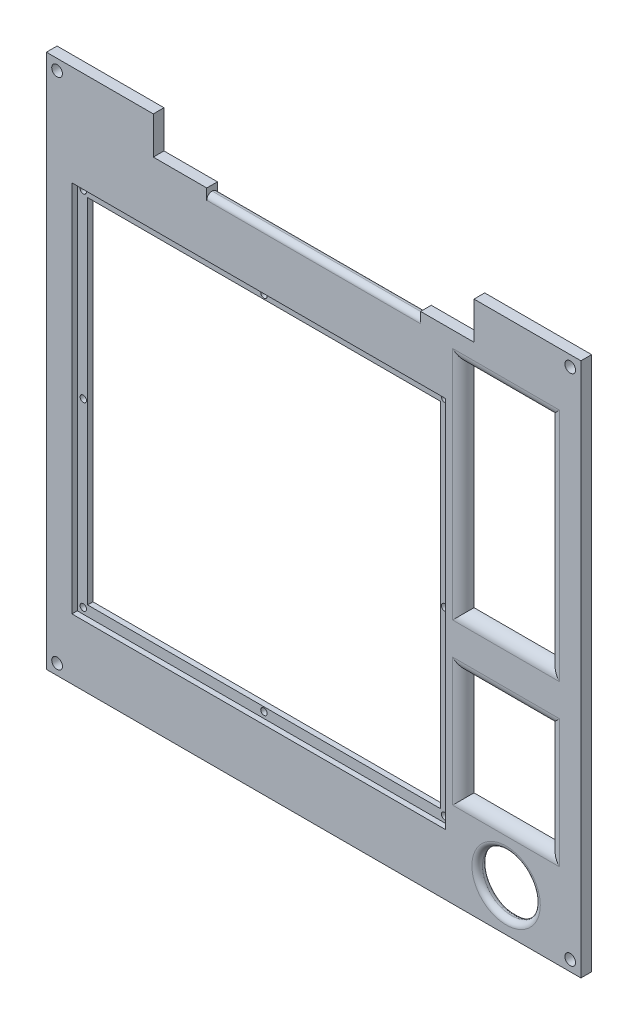
from build123d import *

# Parameters (mm, degrees)
SKETCH1_W                        = 250
SKETCH1_H                        = 250
BOSS_EXTRUDE1_DEPTH              = 50
SKETCH2_W                        = 40
SKETCH2_H                        = 100
SKETCH2_H_2                      = 50
CUT_EXTRUDE1_DEPTH               = 45
FILLET1_R                        = 5
FILLET2_R                        = 5
SKETCH5_R                        = 6.25
CUT_EXTRUDE2_DEPTH               = 22
FILLET5_R                        = 1.5
LPATTERN4_COUNT                  = 10
LPATTERN4_PITCH                  = 16.5
LPATTERN4_COUNT_DIR2             = 10
LPATTERN4_PITCH_DIR2             = 16.5
FILLET5_OF_LPATTERN4_R           = 1.5
CUT_EXTRUDE4_DEPTH               = 45
SKETCH8_W                        = 100
SKETCH8_H                        = 20
CUT_EXTRUDE5_DEPTH               = 30
FILLET6_R                        = 2.5
FILLET7_R                        = 2
SKETCH10_R                       = 13.5
CUT_EXTRUDE6_DEPTH               = 358.071421427
SKETCH4_W                        = 25
SKETCH4_H                        = 17.5
CUT_EXTRUDE7_DEPTH               = 10
VERRUNDUNG1_R                    = 2.5
SKIZZE2_W                        = 25
SKIZZE2_H                        = 5
AUFSATZ_LINEAR_AUSTRAGEN1_DEPTH  = 12.5
AUFSATZ_LINEAR_AUSTRAGEN2_DEPTH  = 10
SKIZZE11_W                       = 164
SKIZZE11_H                       = 164
SCHNITT_LINEAR_AUSTRAGEN6_DEPTH  = 10
SKIZZE12_W                       = 174
SKIZZE12_H                       = 174
SCHNITT_LINEAR_AUSTRAGEN7_DEPTH  = 2.5
SKIZZE13_R                       = 1.5
SCHNITT_LINEAR_AUSTRAGEN8_DEPTH  = 2.5
SKIZZE14_W                       = 10
SKIZZE14_H                       = 10
AUFSATZ_LINEAR_AUSTRAGEN3_DEPTH  = 45
SKIZZE16_W                       = 45
SKIZZE16_H                       = 250
SCHNITT_LINEAR_AUSTRAGEN9_DEPTH  = 358.071421427
SKIZZE17_R                       = 2.5
SCHNITT_LINEAR_AUSTRAGEN10_DEPTH = 5
SKIZZE18_W                       = 174.6
SKIZZE18_H                       = 174.6
SCHNITT_LINEAR_AUSTRAGEN11_DEPTH = 2.5
SKIZZE19_W                       = 165
SKIZZE19_H                       = 165
SCHNITT_LINEAR_AUSTRAGEN12_DEPTH = 2.5


with BuildPart() as part:
    # Sketch1 → Boss-Extrude1 (new body)
    with BuildSketch(Plane.XY):
        with Locations((-125, 125)):
            Rectangle(SKETCH1_W, SKETCH1_H)
    extrude(amount=BOSS_EXTRUDE1_DEPTH)

    # Sketch2 → Cut-Extrude1 (cut)
    with BuildSketch(Plane.XY.offset(50)):
        with Locations((-35, 170)):
            Rectangle(SKETCH2_W, SKETCH2_H)
        with Locations((-35, 70)):
            Rectangle(SKETCH2_W, SKETCH2_H_2)
    extrude(amount=-CUT_EXTRUDE1_DEPTH, mode=Mode.SUBTRACT)

    # Fillet1
    fillet1_edges = [part.edges().sort_by_distance(p)[0] for p in [
        (-55, 170, 50),
        (-35, 120, 50),
        (-15, 170, 50),
        (-35, 220, 50),
    ]]
    fillet(fillet1_edges, radius=FILLET1_R)

    # Fillet2
    fillet2_edges = [part.edges().sort_by_distance(p)[0] for p in [
        (-55, 70, 50),
        (-35, 45, 50),
        (-15, 70, 50),
        (-35, 95, 50),
    ]]
    fillet(fillet2_edges, radius=FILLET2_R)

    # Sketch5 → Cut-Extrude2 (cut)
    with BuildSketch(Plane.XY.offset(50)):
        with Locations((-225, 190)):
            Circle(SKETCH5_R)
    cut_extrude2 = extrude(amount=-CUT_EXTRUDE2_DEPTH, mode=Mode.SUBTRACT)

    # Fillet5
    fillet5_edges = [part.edges().sort_by_distance(p)[0] for p in [
        (-231.25, 190, 50),
    ]]
    fillet(fillet5_edges, radius=FILLET5_R)

    # LPattern4: Cut-Extrude2 10 × 10
    with Locations(*[(i * LPATTERN4_PITCH, -j * LPATTERN4_PITCH_DIR2, 0) for i in range(LPATTERN4_COUNT) for j in range(LPATTERN4_COUNT_DIR2) if (i, j) != (0, 0)]):
        add(cut_extrude2, mode=Mode.SUBTRACT)

    # Fillet5 of LPattern4
    fillet5_of_lpattern4_edges = [part.edges().sort_by_distance(p)[0] for p in [
        (-231.25, 173.5, 50),
        (-231.25, 157, 50),
        (-231.25, 140.5, 50),
        (-231.25, 124, 50),
        (-231.25, 107.5, 50),
        (-231.25, 91, 50),
        (-231.25, 74.5, 50),
        (-231.25, 58, 50),
        (-231.25, 41.5, 50),
        (-214.75, 190, 50),
        (-214.75, 173.5, 50),
        (-214.75, 157, 50),
        (-214.75, 140.5, 50),
        (-214.75, 124, 50),
        (-214.75, 107.5, 50),
        (-214.75, 91, 50),
        (-214.75, 74.5, 50),
        (-214.75, 58, 50),
        (-214.75, 41.5, 50),
        (-198.25, 190, 50),
        (-198.25, 173.5, 50),
        (-198.25, 157, 50),
        (-198.25, 140.5, 50),
        (-198.25, 124, 50),
        (-198.25, 107.5, 50),
        (-198.25, 91, 50),
        (-198.25, 74.5, 50),
        (-198.25, 58, 50),
        (-198.25, 41.5, 50),
        (-181.75, 190, 50),
        (-181.75, 173.5, 50),
        (-181.75, 157, 50),
        (-181.75, 140.5, 50),
        (-181.75, 124, 50),
        (-181.75, 107.5, 50),
        (-181.75, 91, 50),
        (-181.75, 74.5, 50),
        (-181.75, 58, 50),
        (-181.75, 41.5, 50),
        (-165.25, 190, 50),
        (-165.25, 173.5, 50),
        (-165.25, 157, 50),
        (-165.25, 140.5, 50),
        (-165.25, 124, 50),
        (-165.25, 107.5, 50),
        (-165.25, 91, 50),
        (-165.25, 74.5, 50),
        (-165.25, 58, 50),
        (-165.25, 41.5, 50),
        (-148.75, 190, 50),
        (-148.75, 173.5, 50),
        (-148.75, 157, 50),
        (-148.75, 140.5, 50),
        (-148.75, 124, 50),
        (-148.75, 107.5, 50),
        (-148.75, 91, 50),
        (-148.75, 74.5, 50),
        (-148.75, 58, 50),
        (-148.75, 41.5, 50),
        (-132.25, 190, 50),
        (-132.25, 173.5, 50),
        (-132.25, 157, 50),
        (-132.25, 140.5, 50),
        (-132.25, 124, 50),
        (-132.25, 107.5, 50),
        (-132.25, 91, 50),
        (-132.25, 74.5, 50),
        (-132.25, 58, 50),
        (-132.25, 41.5, 50),
        (-115.75, 190, 50),
        (-115.75, 173.5, 50),
        (-115.75, 157, 50),
        (-115.75, 140.5, 50),
        (-115.75, 124, 50),
        (-115.75, 107.5, 50),
        (-115.75, 91, 50),
        (-115.75, 74.5, 50),
        (-115.75, 58, 50),
        (-115.75, 41.5, 50),
        (-99.25, 190, 50),
        (-99.25, 173.5, 50),
        (-99.25, 157, 50),
        (-99.25, 140.5, 50),
        (-99.25, 124, 50),
        (-99.25, 107.5, 50),
        (-99.25, 91, 50),
        (-99.25, 74.5, 50),
        (-99.25, 58, 50),
        (-99.25, 41.5, 50),
        (-82.75, 190, 50),
        (-82.75, 173.5, 50),
        (-82.75, 157, 50),
        (-82.75, 140.5, 50),
        (-82.75, 124, 50),
        (-82.75, 107.5, 50),
        (-82.75, 91, 50),
        (-82.75, 74.5, 50),
        (-82.75, 58, 50),
        (-82.75, 41.5, 50),
    ]]
    fillet(fillet5_of_lpattern4_edges, radius=FILLET5_OF_LPATTERN4_R)

    # Sketch7 → Cut-Extrude4 (cut)
    with BuildSketch(Plane(origin=(0, 0, 0), x_dir=(-1, 0, 0), z_dir=(0, 0, -1))):
        Polygon((5, 245), (245, 245), (245, 5), (5, 5), (5, 40), (60, 40), (60, 100), (5, 100), (5, 115), (60, 115), (60, 225), (5, 225), align=None)
    extrude(amount=-CUT_EXTRUDE4_DEPTH, mode=Mode.SUBTRACT)

    # Sketch8 → Cut-Extrude5 (cut)
    with BuildSketch(Plane.XY.offset(50)):
        with Locations((-125, 240)):
            Rectangle(SKETCH8_W, SKETCH8_H)
    extrude(amount=-CUT_EXTRUDE5_DEPTH, mode=Mode.SUBTRACT)

    # Fillet6
    fillet6_edges = [part.edges().sort_by_distance(p)[0] for p in [
        (-125, 230, 45),
        (-125, 230, 50),
    ]]
    fillet(fillet6_edges, radius=FILLET6_R - 0.0001)  # a hair under: the kernel refuses the full size

    # Fillet7
    fillet7_edges = [part.edges().sort_by_distance(p)[0] for p in [
        (-125, 245, 20),
        (-125, 250, 20),
    ]]
    fillet(fillet7_edges, radius=FILLET7_R)

    # Sketch10 → Cut-Extrude6 (cut, through all)
    with BuildSketch(Plane.XY.offset(50)):
        with Locations((-35, 20)):
            Circle(SKETCH10_R)
    extrude(amount=-CUT_EXTRUDE6_DEPTH, mode=Mode.SUBTRACT)

    # Sketch4 → Cut-Extrude7 (cut)
    with BuildSketch(Plane.XY.offset(50)):
        with Locations((-187.5, 241.25)):
            Rectangle(SKETCH4_W, SKETCH4_H)
        with Locations((-62.5, 241.25)):
            Rectangle(SKETCH4_W, SKETCH4_H)
    extrude(amount=-CUT_EXTRUDE7_DEPTH, mode=Mode.SUBTRACT)

    # Verrundung1
    verrundung1_edges = [part.edges().sort_by_distance(p)[0] for p in [
        (-48.5, 20, 45),
        (-48.5, 20, 50),
    ]]
    fillet(verrundung1_edges, radius=VERRUNDUNG1_R - 0.0001)  # a hair under: the kernel refuses the full size

    # Skizze2 → Aufsatz-Linear austragen1 (add)
    with BuildSketch(Plane.XZ.offset(-245)):
        with Locations((-187.5, 37.5)):
            Rectangle(SKIZZE2_W, SKIZZE2_H)
        with Locations((-62.5, 37.5)):
            Rectangle(SKIZZE2_W, SKIZZE2_H)
    extrude(amount=AUFSATZ_LINEAR_AUSTRAGEN1_DEPTH)

    # Skizze4 → Aufsatz-Linear austragen2 (add)
    with BuildSketch(Plane(origin=(0, 0, 45), x_dir=(-1, 0, 0), z_dir=(0, 0, -1))):
        Polygon((50, 232.5), (75, 232.5), (75, 227.5), (49, 227.5), (49, 245), (50, 245), align=None)
        Polygon((200, 232.5), (175, 232.5), (175, 227.5), (201, 227.5), (201, 245), (200, 245), align=None)
    extrude(amount=AUFSATZ_LINEAR_AUSTRAGEN2_DEPTH)

    # Skizze11 → Schnitt-Linear austragen6 (cut)
    with BuildSketch(Plane.XY.offset(50)):
        with Locations((-150.75, 115.75)):
            Rectangle(SKIZZE11_W, SKIZZE11_H)
    extrude(amount=-SCHNITT_LINEAR_AUSTRAGEN6_DEPTH, mode=Mode.SUBTRACT)

    # Skizze12 → Schnitt-Linear austragen7 (cut)
    with BuildSketch(Plane.XY.offset(50)):
        with Locations((-150.75, 115.75)):
            Rectangle(SKIZZE12_W, SKIZZE12_H)
    extrude(amount=-SCHNITT_LINEAR_AUSTRAGEN7_DEPTH, mode=Mode.SUBTRACT)

    # Skizze13 → Schnitt-Linear austragen8 (cut)
    with BuildSketch(Plane.XY.offset(47.5)):
        with Locations((-235.25, 200.25)):
            Circle(SKIZZE13_R)
        with Locations((-150.75, 200.25)):
            Circle(SKIZZE13_R)
        with Locations((-66.25, 200.25)):
            Circle(SKIZZE13_R)
        with Locations((-235.25, 115.75)):
            Circle(SKIZZE13_R)
        with Locations((-66.25, 115.75)):
            Circle(SKIZZE13_R)
        with Locations(Location((-66.25, 31.25, 0), (0, 0, 180))):
            Circle(SKIZZE13_R)
        with Locations(Location((-150.75, 31.25, 0), (0, 0, 180))):
            Circle(SKIZZE13_R)
        with Locations(Location((-235.25, 31.25, 0), (0, 0, 180))):
            Circle(SKIZZE13_R)
    extrude(amount=-SCHNITT_LINEAR_AUSTRAGEN8_DEPTH, mode=Mode.SUBTRACT)

    # Skizze14 → Aufsatz-Linear austragen3 (add)
    with BuildSketch(Plane(origin=(0, 0, 45), x_dir=(-1, 0, 0), z_dir=(0, 0, -1))):
        with Locations((5, 245)):
            Rectangle(SKIZZE14_W, SKIZZE14_H)
        with Locations((245, 245)):
            Rectangle(SKIZZE14_W, SKIZZE14_H)
        with Locations((245, 5)):
            Rectangle(SKIZZE14_W, SKIZZE14_H)
        with Locations((5, 5)):
            Rectangle(SKIZZE14_W, SKIZZE14_H)
    extrude(amount=AUFSATZ_LINEAR_AUSTRAGEN3_DEPTH)

    # Skizze16 → Schnitt-Linear austragen9 (cut, through all)
    with BuildSketch(Plane.ZY.offset(250)):
        with Locations((22.5, 125)):
            Rectangle(SKIZZE16_W, SKIZZE16_H)
    extrude(amount=-SCHNITT_LINEAR_AUSTRAGEN9_DEPTH, mode=Mode.SUBTRACT)

    # Skizze17 → Schnitt-Linear austragen10 (cut)
    with BuildSketch(Plane.XY.offset(50)):
        with Locations((-245, 245)):
            Circle(SKIZZE17_R)
        with Locations((-5, 245)):
            Circle(SKIZZE17_R)
        with Locations((-5, 5)):
            Circle(SKIZZE17_R)
        with Locations((-245, 5)):
            Circle(SKIZZE17_R)
    extrude(amount=-SCHNITT_LINEAR_AUSTRAGEN10_DEPTH, mode=Mode.SUBTRACT)

    # Skizze18 → Schnitt-Linear austragen11 (cut)
    with BuildSketch(Plane.XY.offset(50)):
        with Locations((-150.75, 115.75)):
            Rectangle(SKIZZE18_W, SKIZZE18_H)
    extrude(amount=-SCHNITT_LINEAR_AUSTRAGEN11_DEPTH, mode=Mode.SUBTRACT)

    # Skizze19 → Schnitt-Linear austragen12 (cut)
    with BuildSketch(Plane.XY.offset(47.5)):
        with Locations((-150.75, 115.75)):
            Rectangle(SKIZZE19_W, SKIZZE19_H)
    extrude(amount=-SCHNITT_LINEAR_AUSTRAGEN12_DEPTH, mode=Mode.SUBTRACT)


solid = part.part
